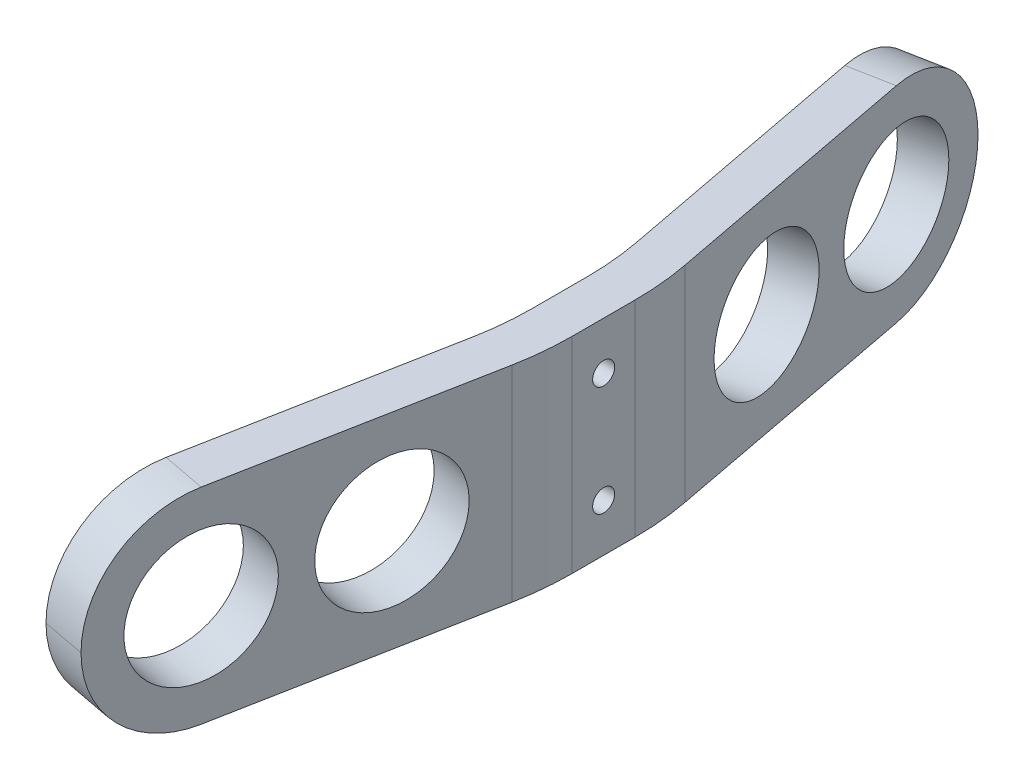
from build123d import *

# Parameters (mm, degrees)
BOSS_EXTRUDE1_DEPTH = 28
FILLET1_R           = 40
CUT_EXTRUDE1_REACH  = 74.186
SKETCH2_R           = 9
CUT_EXTRUDE2_REACH  = 71.108
SKETCH3_R           = 1.5
FILLET2_R           = 14


with BuildPart() as part:
    # Sketch1 → Boss-Extrude1 (new body)
    with BuildSketch(Plane(origin=(0, 0, 0), x_dir=(1, 0, 0), z_dir=(0, 1, 0))):
        Polygon((0, 60), (10, 7.5), (10, -7.5), (0, -60), (5.894031399, -61.122672647), (16, -8.06633749), (16, 8.06633749), (5.894031399, 61.122672647), align=None)
    extrude(amount=BOSS_EXTRUDE1_DEPTH)

    # Fillet1
    fillet1_edges = [part.edges().sort_by_distance(p)[0] for p in [
        (10, 14, 7.5),
        (10, 14, -7.5),
        (16, 14, -8.06633749),
        (16, 14, 8.06633749),
    ]]
    fillet(fillet1_edges, radius=FILLET1_R)

    # Sketch2 → Cut-Extrude1 (cut, up to next)
    with BuildSketch(Plane(origin=(16.922477788, 0, 3.223329102), x_dir=(0.1871121078899954, 0, -0.9823385664224749), z_dir=(0.9823385664224749, 0, 0.1871121078899954)), mode=Mode.PRIVATE) as cut_extrude1_sk1:
        with Locations((-44.940313985, 14)):
            Circle(SKETCH2_R)
    cut_extrude1_tool1 = extrude(cut_extrude1_sk1.sketch, amount=-CUT_EXTRUDE1_REACH, mode=Mode.PRIVATE) & part.part
    # Sketch2 → Cut-Extrude1 (cut, up to next)
    with BuildSketch(Plane(origin=(16.922477788, 0, 3.223329102), x_dir=(0.1871121078899954, 0, -0.9823385664224749), z_dir=(0.9823385664224749, 0, 0.1871121078899954)), mode=Mode.PRIVATE) as cut_extrude1_sk2:
        with Locations((-22.705663944, 14)):
            Circle(SKETCH2_R)
    cut_extrude1_tool2 = extrude(cut_extrude1_sk2.sketch, amount=-CUT_EXTRUDE1_REACH, mode=Mode.PRIVATE) & part.part
    cut_extrude1_1 = cut_extrude1_tool1.solids().sort_by_distance((8.513601, 14, 47.369933))[0]
    add(cut_extrude1_1, mode=Mode.SUBTRACT)
    cut_extrude1_2 = cut_extrude1_tool2.solids().sort_by_distance((12.673973, 14, 25.527978))[0]
    add(cut_extrude1_2, mode=Mode.SUBTRACT)
    cut_extrude1 = cut_extrude1_1 + cut_extrude1_2  # Cut-Extrude1 as one shape, for the pattern or mirror that repeats it

    # Mirror1: Cut-Extrude1 across plane
    add(cut_extrude1.mirror(Plane.XY), mode=Mode.SUBTRACT)

    # Sketch3 → Cut-Extrude2 (cut, up to next)
    with BuildSketch(Plane(origin=(16, 0, 0), x_dir=(0, 0, -1), z_dir=(1, 0, 0)), mode=Mode.PRIVATE) as cut_extrude2_sk1:
        with Locations((0, 21.5)):
            Circle(SKETCH3_R)
    cut_extrude2_tool1 = extrude(cut_extrude2_sk1.sketch, amount=-CUT_EXTRUDE2_REACH, mode=Mode.PRIVATE) & part.part
    # Sketch3 → Cut-Extrude2 (cut, up to next)
    with BuildSketch(Plane(origin=(16, 0, 0), x_dir=(0, 0, -1), z_dir=(1, 0, 0)), mode=Mode.PRIVATE) as cut_extrude2_sk2:
        with Locations((0, 6.5)):
            Circle(SKETCH3_R)
    cut_extrude2_tool2 = extrude(cut_extrude2_sk2.sketch, amount=-CUT_EXTRUDE2_REACH, mode=Mode.PRIVATE) & part.part
    add(cut_extrude2_tool1.solids().sort_by_distance((16, 21.5, 0))[0], mode=Mode.SUBTRACT)
    add(cut_extrude2_tool2.solids().sort_by_distance((16, 6.5, 0))[0], mode=Mode.SUBTRACT)

    # Fillet2
    fillet2_edges = [part.edges().sort_by_distance(p)[0] for p in [
        (2.947015699, 0, -60.561336324),
        (2.947015699, 28, -60.561336324),
        (2.947015699, 0, 60.561336324),
        (2.947015699, 28, 60.561336324),
    ]]
    fillet(fillet2_edges, radius=FILLET2_R - 0.0001)  # a hair under: the kernel refuses the full size


solid = part.part
